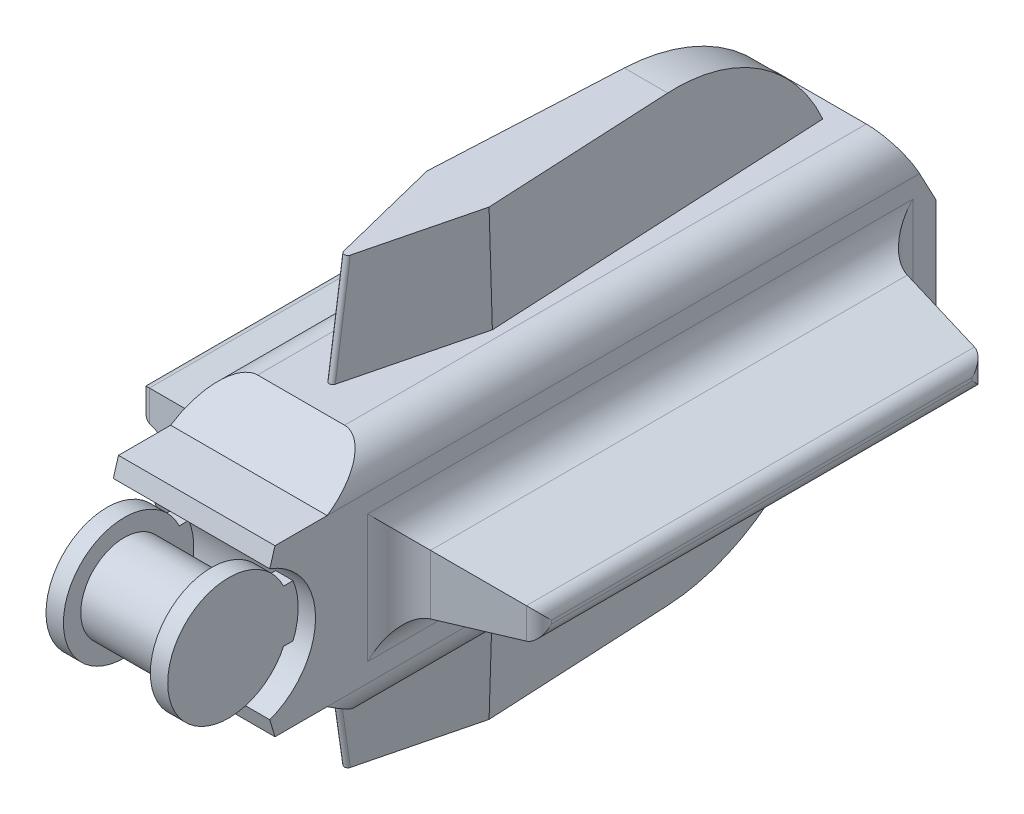
from build123d import *

# Parameters (mm, degrees)
SKETCH1_R                = 3.175
BOSS_EXTRUDE1_DEPTH      = 3.175
SKETCH2_R                = 4.444999999999999
BOSS_EXTRUDE2_DEPTH      = 1.27
BOSS_EXTRUDE3_DEPTH      = 1.27
BOSS_EXTRUDE4_DEPTH      = 8.89
BOSS_EXTRUDE4_DEPTH_BACK = 2.54
SKETCH5_R                = 3.175
CUT_EXTRUDE1_DEPTH       = 12.7
FILLET1_R                = 2.54
SKETCH6_W                = 35.559999999999995
SKETCH6_H                = 5.08
BOSS_EXTRUDE5_DEPTH      = 8.889999999999999
BOSS_EXTRUDE5_TAPER      = 10.000000000000021
FILLET2_R                = 1.016
FILLET3_R                = 2.54
BOSS_EXTRUDE6_DEPTH      = 7.619999999999995
BOSS_EXTRUDE6_TAPER      = 2.000000000000002
FILLET4_R                = 0.254
FILLET5_R                = 12.7


with BuildPart() as part:
    # Sketch1 → Boss-Extrude1 (new, symmetric)
    with BuildSketch(Plane(origin=(0, 0, 0), x_dir=(0, 0, -1), z_dir=(1, 0, 0))):
        Circle(SKETCH1_R)
    extrude(amount=BOSS_EXTRUDE1_DEPTH, both=True)

    # Sketch2 → Boss-Extrude2 (add)
    with BuildSketch(Plane(origin=(3.175, 0, 0), x_dir=(0, 0, -1), z_dir=(1, 0, 0))):
        Circle(SKETCH2_R)
    boss_extrude2 = extrude(amount=BOSS_EXTRUDE2_DEPTH)

    # Mirror1: Boss-Extrude2 across plane
    add(boss_extrude2.mirror(Plane(origin=(0, 0, 0), x_dir=(0, 0, 1), z_dir=(1, 0, 0))))

    # Sketch3 → Boss-Extrude3 (add)
    with BuildSketch(Plane(origin=(4.445, 0, 0), x_dir=(0, 0, -1), z_dir=(1, 0, 0))):
        Polygon((-7.3e-16, 1.9049999999999998), (6.349999999999998, 1.9050000000000038), (6.349999999999999, -1.9049999999999998), (4.4e-16, -1.9049999999999998), align=None)
    boss_extrude3 = extrude(amount=-BOSS_EXTRUDE3_DEPTH)

    # Mirror2: Boss-Extrude3 across plane
    add(boss_extrude3.mirror(Plane(origin=(0, 0, 0), x_dir=(0, 0, 1), z_dir=(1, 0, 0))))

    # Sketch4 → Boss-Extrude4 (add, two sides: drawn at the far end of the back side and taken through both)
    with BuildSketch(Plane(origin=(-3.175, 0, 0), x_dir=(0, 0, -1), z_dir=(1, 0, 0)).offset(-BOSS_EXTRUDE4_DEPTH_BACK)):
        with BuildLine():
            Line((1.7374623280944008, 4.773638513592414), (2.1184623280943997, 6.0436385135924136))
            Line((2.1184623280943997, 6.0436385135924136), (5.928462328094399, 6.0436385135924136))
            Line((5.928462328094399, 6.0436385135924136), (9.738462328094398, 8.583638513592414))
            Line((9.738462328094398, 8.583638513592414), (47.838462328094394, 8.583638513592414))
            Line((47.838462328094394, 8.583638513592414), (50.3784623280944, 3.8099999999999996))
            Line((50.3784623280944, 3.8099999999999996), (50.3784623280944, -3.8099999999999996))
            Line((50.3784623280944, -3.8099999999999996), (47.838462328094394, -8.583638513592414))
            Line((47.838462328094394, -8.583638513592414), (9.738462328094398, -8.583638513592414))
            Line((9.738462328094398, -8.583638513592414), (5.928462328094399, -6.0436385135924136))
            Line((5.928462328094399, -6.0436385135924136), (2.1184623280943997, -6.0436385135924136))
            Line((2.1184623280943997, -6.0436385135924136), (1.7374623280944008, -4.773638513592414))
            ThreePointArc((1.7374623280944008, -4.773638513592414), (5.080000000000001, 0), (1.7374623280944008, 4.773638513592414))
        make_face()
    extrude(amount=BOSS_EXTRUDE4_DEPTH + BOSS_EXTRUDE4_DEPTH_BACK)

    # Sketch5 → Cut-Extrude1 (cut)
    with BuildSketch(Plane(origin=(0, 0, -50.3784623280944), x_dir=(-1, 0, 0), z_dir=(0, 0, -1))):
        Circle(SKETCH5_R)
    extrude(amount=-CUT_EXTRUDE1_DEPTH, mode=Mode.SUBTRACT)

    # Fillet1
    fillet1_edges = [part.edges().sort_by_distance(p)[0] for p in [
        (5.715000000000001, -8.583638513592414, -28.788462328094397),
        (-5.715, -8.583638513592414, -28.788462328094397),
        (-5.715, 8.583638513592414, -28.788462328094397),
        (5.715000000000001, 8.583638513592414, -28.788462328094397),
    ]]
    fillet(fillet1_edges, radius=FILLET1_R)

    # Sketch6 → Boss-Extrude5 (add)
    with BuildSketch(Plane(origin=(5.715000000000001, 0, 0), x_dir=(0, 0, -1), z_dir=(1, 0, 0))):
        with Locations((28.7884623280944, 0)):
            Rectangle(SKETCH6_W, SKETCH6_H)
    boss_extrude5 = extrude(amount=BOSS_EXTRUDE5_DEPTH, taper=BOSS_EXTRUDE5_TAPER)

    # Mirror3: Boss-Extrude5 across plane
    add(boss_extrude5.mirror(Plane(origin=(0, 0, 0), x_dir=(0, 0, 1), z_dir=(1, 0, 0))))

    # Fillet2
    fillet2_edges = [part.edges().sort_by_distance(p)[0] for p in [
        (14.605, -1.6e-16, -12.57600918659266),
        (14.605, -0.9724531415017433, -28.788462328094404),
        (14.605, -1.6e-16, -45.00091546959614),
        (14.605, 0.9724531415017431, -28.788462328094397),
        (-14.605, -1.6e-16, -12.57600918659266),
        (-14.605, 0.9724531415017431, -28.788462328094397),
        (-14.605, -1.6e-16, -45.00091546959614),
        (-14.605, -0.9724531415017433, -28.788462328094404),
    ]]
    fillet(fillet2_edges, radius=FILLET2_R)

    # Fillet3
    fillet3_edges = [part.edges().sort_by_distance(p)[0] for p in [
        (5.715000000000001, 0, -11.008462328094403),
        (5.715000000000001, -2.54, -28.7884623280944),
        (5.715000000000001, 0, -46.5684623280944),
        (5.715000000000001, 2.54, -28.7884623280944),
        (-5.715000000000001, 0, -11.008462328094403),
        (-5.715000000000001, -2.54, -28.7884623280944),
        (-5.715000000000001, 0, -46.5684623280944),
        (-5.715000000000001, 2.54, -28.7884623280944),
    ]]
    fillet(fillet3_edges, radius=FILLET3_R)

    # Sketch7 → Boss-Extrude6 (add)
    with BuildSketch(Plane(origin=(0, 8.583638513592414, 0), x_dir=(1, 0, 0), z_dir=(0, 1, 0))):
        Polygon((-1.27, 46.568462328094405), (-2.5399999999999983, 21.168462328094403), (0, 11.0084623280944), (2.5399999999999983, 21.168462328094403), (1.27, 46.568462328094405), align=None)
    boss_extrude6 = extrude(amount=BOSS_EXTRUDE6_DEPTH, taper=BOSS_EXTRUDE6_TAPER)

    # Mirror4: Boss-Extrude6 across plane
    add(boss_extrude6.mirror(Plane.ZX))

    # Fillet4
    fillet4_edges = [part.edges().sort_by_distance(p)[0] for p in [
        (0, 12.39363851359241, -11.557033828646649),
        (0, -12.39363851359241, -11.557033828646649),
    ]]
    fillet(fillet4_edges, radius=FILLET4_R)

    # Fillet5
    # the kernel refuses this fillet: 12.7 mm, written as the material it takes off along each edge
    with BuildSketch(Plane(origin=(29.450991141099852, -16.20363851359241, -46.30236606456729), x_dir=(0, 0.9993908270190958, -0.03489949670250097), z_dir=(-1, 0, 0))) as fillet5_piece_1:
        with BuildLine():
            CenterArc((12.295328982012144, -11.809941091943898), FILLET5_R, 111.57817847820185, 66.42182152179815)
            Line((-0.39693452113037153, -11.366717483822136), (-0.6507797911932232, -11.357853011659701))
            Line((-0.6507797911932232, -11.357853011659701), (-0.2538452700628517, 0.00886447216243529))
            Line((-0.2538452700628517, 0.00886447216243529), (-1.12e-15, 0.25399999999999656))
            ThreePointArc((-1.12e-15, 0.25399999999999656), (3.8123223637785104, 0.2539999999999965), (7.531231042467917, 0.23619882183887903))
            Line((7.531231042467917, 0.23619882183887903), (7.624644727557019, -4e-17))
        make_face()
    extrude(amount=58.90198228219971, mode=Mode.SUBTRACT)
    with BuildSketch(Plane(origin=(29.450991141099852, 16.20363851359241, -46.30236606456729), x_dir=(0, -0.9993908270190958, -0.03489949670250097), z_dir=(-1, 0, 0))) as fillet5_piece_2:
        with BuildLine():
            CenterArc((12.295328982012144, 11.809941091943898), FILLET5_R, 182, 66.42182152179817)
            Line((-0.39693452113037153, 11.366717483822136), (-0.6507797911932232, 11.357853011659701))
            Line((-0.6507797911932232, 11.357853011659701), (-0.2538452700628517, -0.00886447216243529))
            Line((-0.2538452700628517, -0.00886447216243529), (-1.12e-15, -0.25399999999999656))
            ThreePointArc((-1.12e-15, -0.25399999999999656), (3.8123223637785104, -0.2539999999999965), (7.531231042467917, -0.23619882183887903))
            Line((7.531231042467917, -0.23619882183887903), (7.624644727557019, 4e-17))
        make_face()
    extrude(amount=58.90198228219971, mode=Mode.SUBTRACT)


solid = part.part
